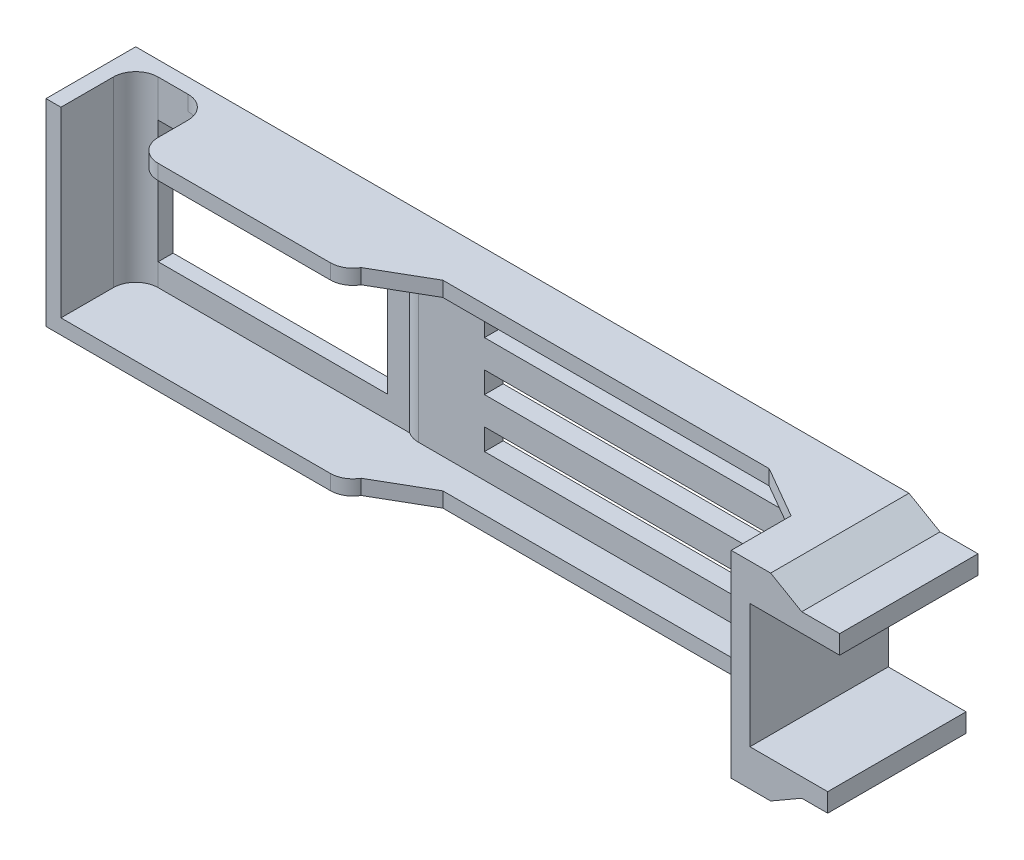
from build123d import *
from OCP.BRepFilletAPI import BRepFilletAPI_MakeChamfer

# Parameters (mm, degrees)
ESQUISSE1_W             = 20.32
ESQUISSE1_H             = 13.2
BOSS_EXTRU_1_DEPTH      = 6
ESQUISSE2_W             = 18.32
ESQUISSE2_H             = 11.2
ENL_V_MAT_EXTRU_1_DEPTH = 5
ESQUISSE3_W             = 5
ESQUISSE3_H             = 1
ENL_V_MAT_EXTRU_2_DEPTH = 5
ESQUISSE4_W             = 15.32
ESQUISSE4_H             = 8.2
ENL_V_MAT_EXTRU_3_DEPTH = 25.741511676
ESQUISSE6_W             = 1
ESQUISSE6_H             = 11.2
ENL_V_MAT_EXTRU_4_DEPTH = 4.75
ESQUISSE7_W             = 30
ESQUISSE7_H             = 13.2
BOSS_EXTRU_2_DEPTH      = 1.25
ESQUISSE8_W             = 1.25
ESQUISSE8_H             = 13.2
BOSS_EXTRU_3_DEPTH      = 8
ESQUISSE9_W             = 9.25
ESQUISSE9_H             = 1.25
BOSS_EXTRU_4_DEPTH      = 6
CHANFREIN1_SIZE         = 2
CHANFREIN1_SIZE_2       = 3.464101615
ESQUISSE10_W            = 28.75
ESQUISSE10_H            = 1
BOSS_EXTRU_5_DEPTH      = 2
CHANFREIN2_SIZE         = 2
CHANFREIN2_SIZE2        = 3.464101615
ESQUISSE11_W            = 21
ESQUISSE11_H            = 1.433492253
ENL_V_MAT_EXTRU_5_DEPTH = 2
ESQUISSE12_W            = 0.8
ESQUISSE12_H            = 9.25
ENL_V_MAT_EXTRU_6_DEPTH = 2
CONG_1_R                = 1.5


with BuildPart() as part:
    # Esquisse1 → Boss.-Extru.1 (new body)
    with BuildSketch(Plane.XY):
        with Locations((10.16, 6.6)):
            Rectangle(ESQUISSE1_W, ESQUISSE1_H)
    extrude(amount=BOSS_EXTRU_1_DEPTH)

    # Esquisse2 → Enlèv. mat.-Extru.1 (cut)
    with BuildSketch(Plane.XY.offset(6)):
        with Locations((10.16, 6.6)):
            Rectangle(ESQUISSE2_W, ESQUISSE2_H)
    extrude(amount=-ENL_V_MAT_EXTRU_1_DEPTH, mode=Mode.SUBTRACT)

    # Esquisse3 → Enlèv. mat.-Extru.2 (cut)
    with BuildSketch(Plane.XY.offset(6)):
        with Locations((3.5, 12.7)):
            Rectangle(ESQUISSE3_W, ESQUISSE3_H)
    extrude(amount=-ENL_V_MAT_EXTRU_2_DEPTH, mode=Mode.SUBTRACT)

    # Esquisse4 → Enlèv. mat.-Extru.3 (cut, through all)
    with BuildSketch(Plane.XY.offset(1)):
        with Locations((10.16, 6.6)):
            Rectangle(ESQUISSE4_W, ESQUISSE4_H)
    extrude(amount=-ENL_V_MAT_EXTRU_3_DEPTH, mode=Mode.SUBTRACT)

    # Esquisse6 → Enlèv. mat.-Extru.4 (cut)
    with BuildSketch(Plane.XY.offset(6)):
        with Locations((19.82, 6.6)):
            Rectangle(ESQUISSE6_W, ESQUISSE6_H)
    extrude(amount=-ENL_V_MAT_EXTRU_4_DEPTH, mode=Mode.SUBTRACT)

    # Esquisse7 → Boss.-Extru.2 (add)
    with BuildSketch(Plane(origin=(0, 0, 0), x_dir=(-1, 0, 0), z_dir=(0, 0, -1))):
        with Locations((-35.32, 6.6)):
            Rectangle(ESQUISSE7_W, ESQUISSE7_H)
    extrude(amount=-BOSS_EXTRU_2_DEPTH)

    # Esquisse8 → Boss.-Extru.3 (add)
    with BuildSketch(Plane.XY.offset(1.25)):
        with Locations((49.695, 6.6)):
            Rectangle(ESQUISSE8_W, ESQUISSE8_H)
    extrude(amount=BOSS_EXTRU_3_DEPTH)

    # Esquisse9 → Boss.-Extru.4 (add)
    with BuildSketch(Plane(origin=(50.32, 0, 0), x_dir=(0, 0, -1), z_dir=(1, 0, 0))):
        with Locations((-4.625, 11.375)):
            Rectangle(ESQUISSE9_W, ESQUISSE9_H)
        with Locations((-4.625, 1.825)):
            Rectangle(ESQUISSE9_W, ESQUISSE9_H)
    extrude(amount=BOSS_EXTRU_4_DEPTH)

    # Chanfrein1
    # the kernel refuses this chamfer: 3.464101615, 2 mm, written as the material it adds along each edge
    with BuildSketch(Plane(origin=(50.32, 12, 9.25), x_dir=(0, 1, 0), z_dir=(0, 0, -1))) as chanfrein1_piece_1_section:
        Polygon((CHANFREIN1_SIZE, 0), (0, CHANFREIN1_SIZE_2), (0, 0), align=None)
    chanfrein1_piece_1 = extrude(amount=9.25, mode=Mode.PRIVATE)
    chanfrein1_piece_1 = split(chanfrein1_piece_1, bisect_by=Plane(origin=(50.32, 13.2, 9.25), z_dir=(0, -1, 0)), keep=Keep.TOP, mode=Mode.PRIVATE)
    add(chanfrein1_piece_1)
    with BuildSketch(Plane(origin=(50.32, 1.2, 0), x_dir=(0, -1, 0), z_dir=(0, 0, 1))) as chanfrein1_piece_2_section:
        Polygon((CHANFREIN1_SIZE, 0), (0, CHANFREIN1_SIZE_2), (0, 0), align=None)
    chanfrein1_piece_2 = extrude(amount=9.25, mode=Mode.PRIVATE)
    chanfrein1_piece_2 = split(chanfrein1_piece_2, bisect_by=Plane(origin=(50.32, 0, 0), z_dir=(0, 1, 0)), keep=Keep.TOP, mode=Mode.PRIVATE)
    add(chanfrein1_piece_2)

    # Esquisse10 → Boss.-Extru.5 (add)
    with BuildSketch(Plane.XY.offset(1.25)):
        with Locations((34.695, 12.7)):
            Rectangle(ESQUISSE10_W, ESQUISSE10_H)
        with Locations((34.695, 0.5)):
            Rectangle(ESQUISSE10_W, ESQUISSE10_H)
    extrude(amount=BOSS_EXTRU_5_DEPTH)

    # Chanfrein2: one chamfer whose edges measure the first distance from different faces: ONE call of the kernel's chamfer builder (chamfer() names one face for all edges)
    chanfrein2_edges_1 = [part.edges().sort_by_distance(p)[0] for p in [
        (20.32, 12.7, 3.25),
    ]]
    chanfrein2_side_1 = [part.faces().sort_by_distance(p)[0] for p in [
        (20.32, 12.7, 4.625),
    ]]
    chanfrein2_edges_2 = [part.edges().sort_by_distance(p)[0] for p in [
        (49.07, 12.7, 3.25),
        (49.07, 0.5, 3.25),
    ]]
    chanfrein2_side_2 = [part.faces().sort_by_distance(p)[0] for p in [
        (49.07, 6.6, 5.368110236),
    ]]
    chanfrein2_edges_3 = [part.edges().sort_by_distance(p)[0] for p in [
        (20.32, 0.5, 3.25),
    ]]
    chanfrein2_side_3 = [part.faces().sort_by_distance(p)[0] for p in [
        (20.32, 0.5, 4.625),
    ]]
    chanfrein2 = BRepFilletAPI_MakeChamfer(part.part.solid().wrapped)
    for e in chanfrein2_edges_1:
        chanfrein2.Add(CHANFREIN2_SIZE, CHANFREIN2_SIZE2, e.wrapped, chanfrein2_side_1[0].wrapped)  # the first distance lies on this face
    for e in chanfrein2_edges_2:
        chanfrein2.Add(CHANFREIN2_SIZE, CHANFREIN2_SIZE2, e.wrapped, chanfrein2_side_2[0].wrapped)  # the first distance lies on this face
    for e in chanfrein2_edges_3:
        chanfrein2.Add(CHANFREIN2_SIZE, CHANFREIN2_SIZE2, e.wrapped, chanfrein2_side_3[0].wrapped)  # the first distance lies on this face
    add(Compound.cast(chanfrein2.Shape()), mode=Mode.REPLACE)

    # Esquisse11 → Enlèv. mat.-Extru.5 (cut)
    with BuildSketch(Plane.XY.offset(1.25)):
        with Locations((35.07, 9.983253874)):
            Rectangle(ESQUISSE11_W, ESQUISSE11_H)
        with Locations((35.07, 6.683253873)):
            Rectangle(ESQUISSE11_W, ESQUISSE11_H)
        with Locations((35.07, 3.383253874)):
            Rectangle(ESQUISSE11_W, ESQUISSE11_H)
    extrude(amount=-ENL_V_MAT_EXTRU_5_DEPTH, mode=Mode.SUBTRACT)

    # Esquisse12 → Enlèv. mat.-Extru.6 (cut)
    with BuildSketch(Plane(origin=(0, 1.2, 0), x_dir=(-1, 0, 0), z_dir=(0, -1, 0))):
        with Locations((-55.92, -4.625)):
            Rectangle(ESQUISSE12_W, ESQUISSE12_H)
    extrude(amount=-ENL_V_MAT_EXTRU_6_DEPTH, mode=Mode.SUBTRACT)

    # Congé1
    # the kernel refuses this fillet: 1.5 mm, written as the material it adds along each edge
    with BuildSketch(Plane(origin=(1, 1, 1), x_dir=(0, 0, 1), z_dir=(0, 1, 0))) as cong_1_piece_1:
        with BuildLine():
            CenterArc((CONG_1_R, CONG_1_R), CONG_1_R, 180, 90)
            Line((0, CONG_1_R), (0, 0))
            Line((0, 0), (CONG_1_R, 0))
        make_face()
    extrude(amount=12.2)
    with BuildSketch(Plane(origin=(6, 12.2, 1), x_dir=(-1, 0, 0), z_dir=(0, 1, 0))) as cong_1_piece_2:
        with BuildLine():
            CenterArc((CONG_1_R, CONG_1_R), CONG_1_R, 180, 90)
            Line((0, CONG_1_R), (0, 0))
            Line((0, 0), (CONG_1_R, 0))
        make_face()
    extrude(amount=1)
    # the kernel refuses this fillet: 1.5 mm, written as the material it takes off along each edge
    with BuildSketch(Plane(origin=(20.32, -3.247595264, 6), x_dir=(-1, 0, 0), z_dir=(0, 1, 0)), Plane(origin=(20.32, 8.952404736, 6), x_dir=(-1, 0, 0), z_dir=(0, 1, 0))) as cong_1_2_piece_1:
        with BuildLine():
            CenterArc((1.299038106, -1.5), CONG_1_R, 90, 60)
            Line((0, -0.75), (0, 0))
            Line((0, 0), (1.299038106, 0))
        make_face()
    extrude(amount=7.495190528, mode=Mode.SUBTRACT)
    with BuildSketch(Plane(origin=(19.32, 1, 1.25), x_dir=(1, 0, 0), z_dir=(0, 1, 0))) as cong_1_2_piece_2:
        with BuildLine():
            CenterArc((0.829156198, 1.5), CONG_1_R, 236.442690238, 33.557309762)
            Line((0, 0.25), (0, 0))
            Line((0, 0), (0.829156198, 0))
        make_face()
    extrude(amount=11.2, mode=Mode.SUBTRACT)
    with BuildSketch(Plane(origin=(6, 8.45, 6), x_dir=(0, 0, -1), z_dir=(0, 1, 0))) as cong_1_2_piece_3:
        with BuildLine():
            CenterArc((CONG_1_R, -CONG_1_R), CONG_1_R, 90, 90)
            Line((0, -CONG_1_R), (0, 0))
            Line((0, 0), (CONG_1_R, 0))
        make_face()
    extrude(amount=8.5, mode=Mode.SUBTRACT)


solid = part.part
